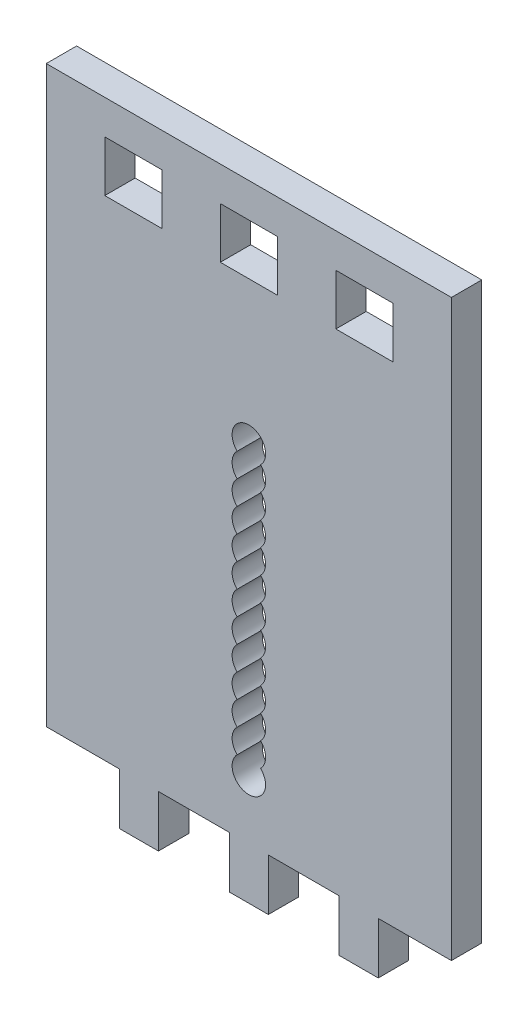
from build123d import *

# Parameters (mm, degrees)
SKETCH1_W                 = 6.042857143
SKETCH1_H                 = 5.4
SKETCH1_W_2               = 6.042857142
SKETCH1_W_3               = 4
BOSS_EXTRUDE1_DEPTH       = 3.175
BOSS_EXTRUDE2_START       = -3.175
BOSS_EXTRUDE2_OUTLINE_W   = 6.042857143
BOSS_EXTRUDE2_OUTLINE_H   = 5.4
BOSS_EXTRUDE2_OUTLINE_W_2 = 5.961577143
BOSS_EXTRUDE2_OUTLINE_H_2 = 5.31872
BOSS_EXTRUDE2_OUTLINE_W_3 = 6.042857142
BOSS_EXTRUDE2_OUTLINE_W_4 = 5.961577142
BOSS_EXTRUDE2_DEPTH       = 3.175


# Read off the part's stored shape, not the designer's step: Boss-Extrude2
with BuildPart() as part:
    # Sketch1 → Boss-Extrude1 (new body)
    # profile 1 of 4: a face of its own
    with BuildSketch(Plane.XY):
        Polygon((21.15, 38.85), (-21.15, 38.85), (-21.15, -21.15), (-13.5, -21.15), (-9.5, -21.15), (-2, -21.15), (2, -21.15), (9.5, -21.15), (13.5, -21.15), (21.15, -21.15), align=None)
        with BuildLine():
            ThreePointArc((-1.224744871, 11.25), (-1.75, 12.5), (-1.224744871, 13.75))
            ThreePointArc((-1.224744871, 13.75), (-0.67793675, 16.613351097), (1.75, 15))
            ThreePointArc((1.75, 15), (1.613351097, 14.32206325), (1.224744871, 13.75))
            ThreePointArc((1.224744871, 13.75), (1.613351097, 13.17793675), (1.75, 12.5))
            ThreePointArc((1.75, 12.5), (1.613351097, 11.82206325), (1.224744871, 11.25))
            ThreePointArc((1.224744871, 11.25), (1.613351097, 10.67793675), (1.75, 10))
            ThreePointArc((1.75, 10), (1.613351097, 9.32206325), (1.224744871, 8.75))
            ThreePointArc((1.224744871, 8.75), (1.613351097, 8.17793675), (1.75, 7.5))
            ThreePointArc((1.75, 7.5), (1.613351097, 6.82206325), (1.224744871, 6.25))
            ThreePointArc((1.224744871, 6.25), (1.613351097, 5.67793675), (1.75, 5))
            ThreePointArc((1.75, 5), (1.613351097, 4.32206325), (1.224744871, 3.75))
            ThreePointArc((1.224744871, 3.75), (1.613351097, 3.17793675), (1.75, 2.5))
            ThreePointArc((1.75, 2.5), (1.613351097, 1.82206325), (1.224744871, 1.25))
            ThreePointArc((1.224744871, 1.25), (1.613351097, 0.67793675), (1.75, 0))
            ThreePointArc((1.75, 0), (1.613351097, -0.67793675), (1.224744871, -1.25))
            ThreePointArc((1.224744871, -1.25), (1.613351097, -1.82206325), (1.75, -2.5))
            ThreePointArc((1.75, -2.5), (1.613351097, -3.17793675), (1.224744871, -3.75))
            ThreePointArc((1.224744871, -3.75), (1.613351097, -4.32206325), (1.75, -5))
            ThreePointArc((1.75, -5), (1.613351097, -5.67793675), (1.224744871, -6.25))
            ThreePointArc((1.224744871, -6.25), (1.613351097, -6.82206325), (1.75, -7.5))
            ThreePointArc((1.75, -7.5), (1.613351097, -8.17793675), (1.224744871, -8.75))
            ThreePointArc((1.224744871, -8.75), (1.613351097, -9.32206325), (1.75, -10))
            ThreePointArc((1.75, -10), (1.613351097, -10.67793675), (1.224744871, -11.25))
            ThreePointArc((1.224744871, -11.25), (1.613351097, -11.82206325), (1.75, -12.5))
            ThreePointArc((1.75, -12.5), (1.613351097, -13.17793675), (1.224744871, -13.75))
            ThreePointArc((1.224744871, -13.75), (1.613351097, -14.32206325), (1.75, -15))
            ThreePointArc((1.75, -15), (-0.67793675, -16.613351097), (-1.224744871, -13.75))
            ThreePointArc((-1.224744871, -13.75), (-1.75, -12.5), (-1.224744871, -11.25))
            ThreePointArc((-1.224744871, -11.25), (-1.75, -10), (-1.224744871, -8.75))
            ThreePointArc((-1.224744871, -8.75), (-1.75, -7.5), (-1.224744871, -6.25))
            ThreePointArc((-1.224744871, -6.25), (-1.75, -5), (-1.224744871, -3.75))
            ThreePointArc((-1.224744871, -3.75), (-1.75, -2.5), (-1.224744871, -1.25))
            ThreePointArc((-1.224744871, -1.25), (-1.75, 0), (-1.224744871, 1.25))
            ThreePointArc((-1.224744871, 1.25), (-1.75, 2.5), (-1.224744871, 3.75))
            ThreePointArc((-1.224744871, 3.75), (-1.75, 5), (-1.224744871, 6.25))
            ThreePointArc((-1.224744871, 6.25), (-1.75, 7.5), (-1.224744871, 8.75))
            ThreePointArc((-1.224744871, 8.75), (-1.75, 10), (-1.224744871, 11.25))
        make_face(mode=Mode.SUBTRACT)
        with Locations((-12.085714285, 32.65)):
            Rectangle(SKETCH1_W, SKETCH1_H, mode=Mode.SUBTRACT)
        with Locations((0, 32.65)):
            Rectangle(SKETCH1_W_2, SKETCH1_H, mode=Mode.SUBTRACT)
        with Locations((12.085714285, 32.65)):
            Rectangle(SKETCH1_W, SKETCH1_H, mode=Mode.SUBTRACT)
    # profile 2 of 4: a face of its own
    with BuildSketch(Plane.XY):
        with Locations((-11.5, -23.85)):
            Rectangle(SKETCH1_W_3, SKETCH1_H)
    # profile 3 of 4: a face of its own
    with BuildSketch(Plane.XY):
        with Locations((11.5, -23.85)):
            Rectangle(SKETCH1_W_3, SKETCH1_H)
    # profile 4 of 4: a face of its own
    with BuildSketch(Plane.XY):
        with Locations((0, -23.85)):
            Rectangle(SKETCH1_W_3, SKETCH1_H)
    extrude(amount=BOSS_EXTRUDE1_DEPTH)

    # Boss-Extrude2 outline → Boss-Extrude2 (add)
    # profile 1 of 4: a face of its own
    with BuildSketch(Plane.XY.offset(3.175).offset(BOSS_EXTRUDE2_START)):
        Polygon((13.54064, -26.59064), (13.54064, -21.19064), (21.19064, -21.19064), (21.19064, 38.89064), (-21.19064, 38.89064), (-21.19064, -21.19064), (-13.54064, -21.19064), (-13.54064, -26.59064), (-9.45936, -26.59064), (-9.45936, -21.19064), (-2.04064, -21.19064), (-2.04064, -26.59064), (2.04064, -26.59064), (2.04064, -21.19064), (9.45936, -21.19064), (9.45936, -26.59064), align=None)
        Polygon((21.15, 38.85), (21.15, -21.15), (13.5, -21.15), (13.5, -26.55), (9.5, -26.55), (9.5, -21.15), (2, -21.15), (2, -26.55), (-2, -26.55), (-2, -21.15), (-9.5, -21.15), (-9.5, -26.55), (-13.5, -26.55), (-13.5, -21.15), (-21.15, -21.15), (-21.15, 38.85), align=None, mode=Mode.SUBTRACT)
    # profile 2 of 4: a face of its own
    with BuildSketch(Plane.XY.offset(3.175).offset(BOSS_EXTRUDE2_START)):
        with Locations((12.085714285, 32.65)):
            Rectangle(BOSS_EXTRUDE2_OUTLINE_W, BOSS_EXTRUDE2_OUTLINE_H)
        with Locations((12.085714285, 32.65)):
            Rectangle(BOSS_EXTRUDE2_OUTLINE_W_2, BOSS_EXTRUDE2_OUTLINE_H_2, mode=Mode.SUBTRACT)
    # profile 3 of 4: a face of its own
    with BuildSketch(Plane.XY.offset(3.175).offset(BOSS_EXTRUDE2_START)):
        with Locations((0, 32.65)):
            Rectangle(BOSS_EXTRUDE2_OUTLINE_W_3, BOSS_EXTRUDE2_OUTLINE_H)
        with Locations((0, 32.65)):
            Rectangle(BOSS_EXTRUDE2_OUTLINE_W_4, BOSS_EXTRUDE2_OUTLINE_H_2, mode=Mode.SUBTRACT)
    # profile 4 of 4: a face of its own
    with BuildSketch(Plane.XY.offset(3.175).offset(BOSS_EXTRUDE2_START)):
        with Locations((-12.085714285, 32.65)):
            Rectangle(BOSS_EXTRUDE2_OUTLINE_W, BOSS_EXTRUDE2_OUTLINE_H)
        with Locations((-12.085714285, 32.65)):
            Rectangle(BOSS_EXTRUDE2_OUTLINE_W_2, BOSS_EXTRUDE2_OUTLINE_H_2, mode=Mode.SUBTRACT)
    extrude(amount=BOSS_EXTRUDE2_DEPTH)


solid = part.part
